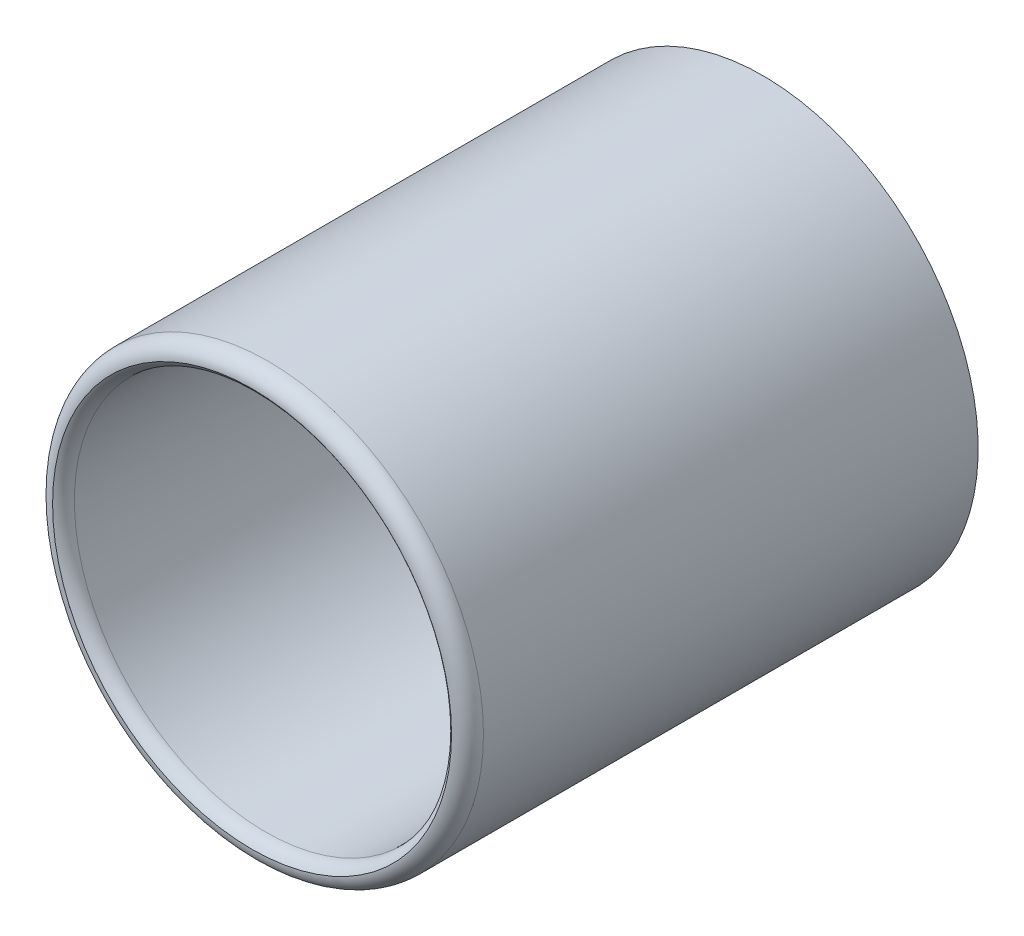
from build123d import *

# Parameters (mm, degrees)
IZIM1_R                     = 67.5
IZIM1_R_2                   = 60
Y_KSEKLIK_EKSTR_ZYON1_DEPTH = 150
Y_KSEKLIK_EKSTR_ZYON2_START = 10
IZIM2_R                     = 67.5
Y_KSEKLIK_EKSTR_ZYON2_DEPTH = 10
RADYUS1_R                   = 5
RADYUS2_R                   = 5


with BuildPart() as part:
    # Çizim1 → Yükseklik-Ekstrüzyon1 (new body)
    with BuildSketch(Plane.XY):
        Circle(IZIM1_R)
        Circle(IZIM1_R_2, mode=Mode.SUBTRACT)
    extrude(amount=Y_KSEKLIK_EKSTR_ZYON1_DEPTH)

    # Çizim2 → Yükseklik-Ekstrüzyon2 (add)
    with BuildSketch(Plane(origin=(0, 0, 0), x_dir=(-1, 0, 0), z_dir=(0, 0, -1)).offset(Y_KSEKLIK_EKSTR_ZYON2_START)):
        Circle(IZIM2_R)
    extrude(amount=-Y_KSEKLIK_EKSTR_ZYON2_DEPTH)

    # Radyus1
    radyus1_edges = [part.edges().sort_by_distance(p)[0] for p in [
        (-67.5, 0, 150),
    ]]
    fillet(radyus1_edges, radius=RADYUS1_R)

    # Radyus2
    # the kernel refuses this fillet: 5 mm, written as the material it takes off along each edge
    with BuildSketch(Plane(origin=(0, 0, 150), x_dir=(1, 0, 0), z_dir=(0, -1, 0))) as radyus2_piece_1:
        with BuildLine():
            CenterArc((65, -4.330127019), RADYUS2_R, 120, 60)
            Line((60, -4.330127019), (59.9, -4.330127019))
            Line((59.9, -4.330127019), (59.9, 0))
            Line((59.9, 0), (60, 0.1))
            ThreePointArc((60, 0.1), (61.25, 0.1), (62.45, 0.08660254))
            Line((62.45, 0.08660254), (62.5, 0))
        make_face()
    revolve(axis=Axis((0, 0, 150), (0, 0, 1)), mode=Mode.SUBTRACT)


solid = part.part
